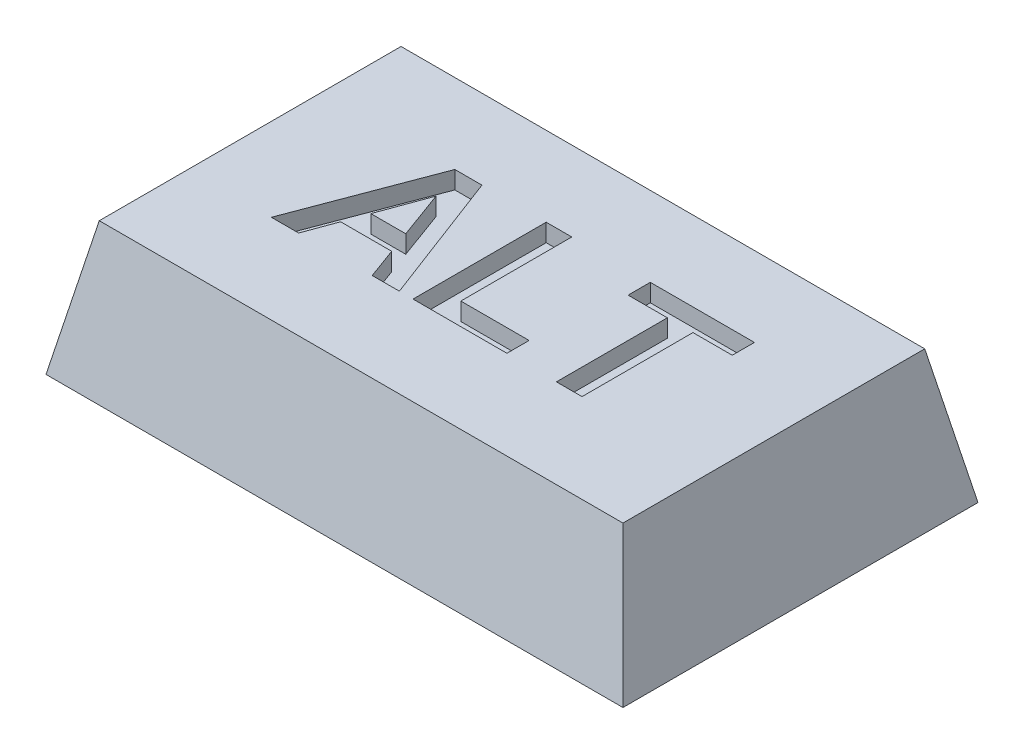
from build123d import *

# Parameters (mm, degrees)
SKETCH1_W               = 13
SKETCH1_H               = 8
BOSS_EXTRUDE1_DEPTH     = 3
CUT_EXTRUDE1_DEPTH      = 16.556349186
CUT_EXTRUDE1_DEPTH_BACK = 16.556349186
CUT_EXTRUDE2_DEPTH      = 16.556349186
CUT_EXTRUDE2_DEPTH_BACK = 16.556349186
SKETCH4_R               = 1.75
CUT_EXTRUDE3_DEPTH      = 0.4
SKETCH5_W               = 8
SKETCH5_H               = 1.1
BOSS_EXTRUDE2_DEPTH     = 2
FILLET1_R               = 4
CUT_EXTRUDE4_DEPTH      = 0.4


with BuildPart() as part:
    # Sketch1 → Boss-Extrude1 (new body)
    with BuildSketch(Plane(origin=(0, 0, 0), x_dir=(1, 0, 0), z_dir=(0, 1, 0))):
        with Locations((6.5, 4)):
            Rectangle(SKETCH1_W, SKETCH1_H)
    extrude(amount=BOSS_EXTRUDE1_DEPTH)

    # Sketch2 → Cut-Extrude1 (cut, two sides: drawn at the far end of the back side and taken through both)
    with BuildSketch(Plane.XY.offset(-CUT_EXTRUDE1_DEPTH_BACK)):
        Polygon((0, 0), (0.6, 3), (0, 3), align=None)
        Polygon((13, 0), (12.4, 3), (13, 3), align=None)
    extrude(amount=CUT_EXTRUDE1_DEPTH + CUT_EXTRUDE1_DEPTH_BACK, mode=Mode.SUBTRACT)

    # Sketch3 → Cut-Extrude2 (cut, two sides: drawn at the far end of the back side and taken through both)
    with BuildSketch(Plane(origin=(0, 0, 0), x_dir=(0, 0, -1), z_dir=(1, 0, 0)).offset(-CUT_EXTRUDE2_DEPTH_BACK)):
        Polygon((0, 0), (0.6, 3), (0, 3), align=None)
        Polygon((8, 3), (7.4, 3), (8, 0), align=None)
    extrude(amount=CUT_EXTRUDE2_DEPTH + CUT_EXTRUDE2_DEPTH_BACK, mode=Mode.SUBTRACT)

    # Sketch4 → Cut-Extrude3 (cut)
    with BuildSketch(Plane.XZ):
        with Locations(Location((6.50000125, -3.75, 0), (0, 0, 270))):
            Circle(SKETCH4_R)
    extrude(amount=-CUT_EXTRUDE3_DEPTH, mode=Mode.SUBTRACT)

    # Sketch5 → Boss-Extrude2 (add)
    with BuildSketch(Plane.XZ):
        with Locations((6.500011, -7.45)):
            Rectangle(SKETCH5_W, SKETCH5_H)
    extrude(amount=BOSS_EXTRUDE2_DEPTH)

    # Fillet1
    # the kernel refuses this fillet: 4 mm, written as the material it takes off along each edge
    with BuildSketch(Plane(origin=(10.500011, -2, -16.660254038), x_dir=(0, 1, 0), z_dir=(0, 0, 1)), Plane(origin=(2.500011, -2, 1.760254038), x_dir=(0, 1, 0), z_dir=(0, 0, -1))) as fillet1_piece_1:
        with BuildLine():
            CenterArc((4, 3.464101615), FILLET1_R, 180, 60)
            Line((0, 3.464101615), (-0.08, 3.464101615))
            Line((-0.08, 3.464101615), (-0.08, 0))
            Line((-0.08, 0), (0, -0.08))
            ThreePointArc((0, -0.08), (1, -0.08), (1.96, -0.069282032))
            Line((1.96, -0.069282032), (2, 0))
        make_face()
    extrude(amount=18.420508076, mode=Mode.SUBTRACT)

    # Sketch6 → Cut-Extrude4 (cut)
    # profile 1 of 3: a face of its own
    with BuildSketch(Plane(origin=(0, 3, 0), x_dir=(1, 0, 0), z_dir=(0, 1, 0))):
        Polygon((5.356583629, 2.605681315), (4.744804782, 2.605681315), (4.491799975, 3.297989008), (3.340357667, 3.297989008), (3.087352859, 2.605681315), (2.471968244, 2.605681315), (3.605982667, 5.605681315), (4.217160552, 5.605681315), align=None)
        Polygon((4.308506705, 3.797989008), (3.914275936, 4.874912084), (3.52124709, 3.797989008), align=None, mode=Mode.SUBTRACT)
    # profile 2 of 3: a face of its own
    with BuildSketch(Plane(origin=(0, 3, 0), x_dir=(1, 0, 0), z_dir=(0, 1, 0))):
        Polygon((5.664275936, 2.605681315), (5.664275936, 5.605681315), (6.241199013, 5.605681315), (6.241199013, 3.105681315), (7.779660552, 3.105681315), (7.779660552, 2.605681315), align=None)
    # profile 3 of 3: a face of its own
    with BuildSketch(Plane(origin=(0, 3, 0), x_dir=(1, 0, 0), z_dir=(0, 1, 0))):
        Polygon((8.895045167, 2.605681315), (8.895045167, 5.105681315), (8.010429782, 5.105681315), (8.010429782, 5.605681315), (10.356583629, 5.605681315), (10.356583629, 5.105681315), (9.471968244, 5.105681315), (9.471968244, 2.605681315), align=None)
    extrude(amount=-CUT_EXTRUDE4_DEPTH, mode=Mode.SUBTRACT)


solid = part.part
